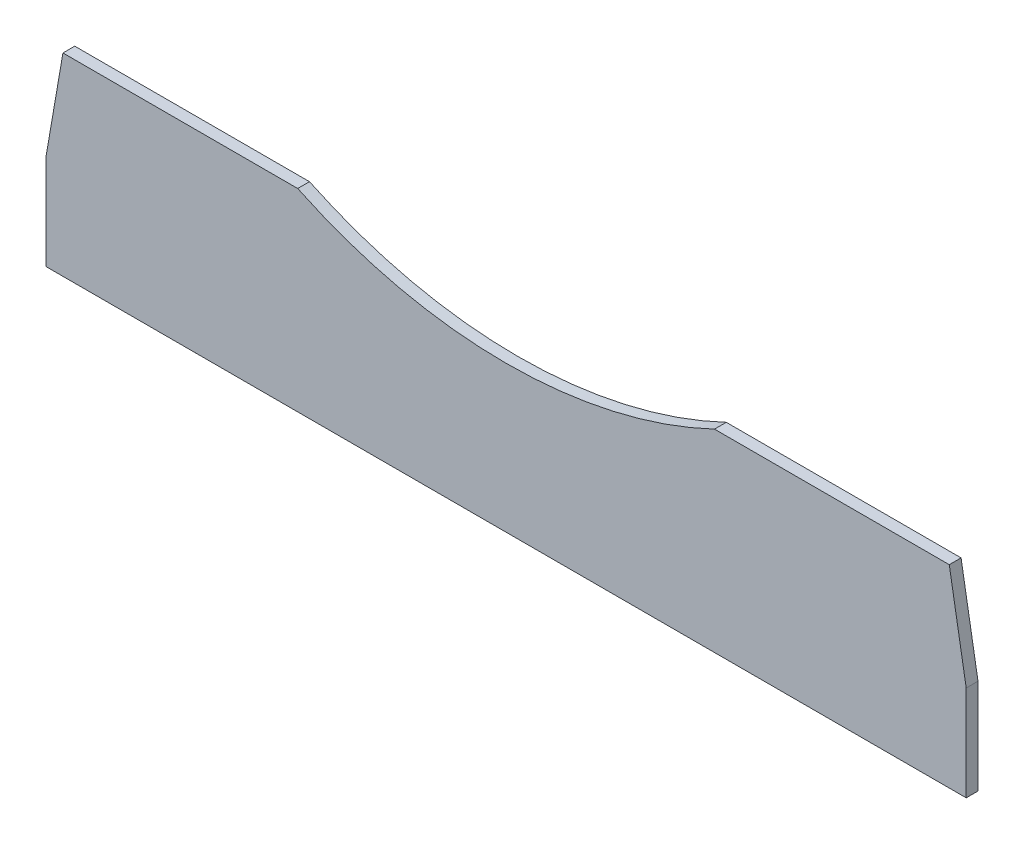
from build123d import *

# Parameters (mm, degrees)
EXTRUDE_1_DEPTH = 1
EXTRUDE_2_DEPTH = 0.2


with BuildPart() as part:
    # 草图1 → 凸台-拉伸1 (new body)
    with BuildSketch(Plane.XY):
        with BuildLine():
            Line((77.564020285, 17.400000002), (57.663521733, 17.400000002))
            ThreePointArc((57.663521733, 17.400000002), (40, 13.400000002), (22.336478267, 17.400000002))
            Line((22.336478267, 17.400000002), (2.435979715, 17.400000002))
            Line((2.435979715, 17.400000002), (1, 9.067418693))
            Line((1, 9.067418693), (1, 1))
            Line((1, 1), (79, 1))
            Line((79, 1), (79, 9.067418693))
            Line((79, 9.067418693), (77.564020285, 17.400000002))
        make_face()
    extrude(amount=EXTRUDE_1_DEPTH)

    # 草图2 → 凸台-拉伸2 (add)
    # profile 1 of 5: a face of its own
    with BuildSketch(Plane(origin=(0, 0, 0), x_dir=(-1, 0, 0), z_dir=(0, 0, -1))):
        with BuildLine():
            Line((-47.688311688, 9.067418693), (-47.688311688, 13.067418693))
            Line((-47.688311688, 13.067418693), (-46.456168831, 13.067418693))
            add(Edge.make_bspline(
                [(-46.456168831, 13.067418693), (-46.420988221, 13.067451705), (-46.353305987, 13.067515216), (-46.255375892, 13.062724044), (-46.164329229, 13.057882688), (-46.080485367, 13.048540998), (-46.003780872, 13.038340211), (-45.934294083, 13.025593097), (-45.872011125, 13.009482907), (-45.833269101, 12.996467591), (-45.814935065, 12.990308303)],
                knots=[0, 0, 0, 0, 1.301145482, 2.503209419, 3.626350361, 4.67304202, 5.622796861, 6.488461115, 7.284688674, 8, 8, 8, 8], degree=3))
            add(Edge.make_bspline(
                [(-45.814935065, 12.990308303), (-45.791719499, 12.981322614), (-45.74534338, 12.963372528), (-45.68001996, 12.927935397), (-45.617705889, 12.888011907), (-45.559107384, 12.842561949), (-45.504568127, 12.790885007), (-45.453234408, 12.734116528), (-45.406126096, 12.671089494), (-45.362722293, 12.603146313), (-45.32230664, 12.530972452), (-45.288936916, 12.453685342), (-45.258960982, 12.372914459), (-45.236153868, 12.287713781), (-45.216879687, 12.198685981), (-45.204603556, 12.105561237), (-45.195853867, 12.008332403), (-45.195160066, 11.942169373), (-45.194805195, 11.908327784)],
                knots=[0, 0, 0, 0, 0.897158766, 1.79219156, 2.674738776, 3.564969572, 4.462552928, 5.381685756, 6.322532571, 7.297145314, 8.28871417, 9.302465757, 10.330585605, 11.393732126, 12.480975679, 13.614163778, 14.779673607, 16, 16, 16, 16], degree=3))
            add(Edge.make_bspline(
                [(-45.194805195, 11.908327784), (-45.195492301, 11.86392354), (-45.196836119, 11.777079255), (-45.210030339, 11.650058884), (-45.23195871, 11.529625528), (-45.261877634, 11.415200622), (-45.300734436, 11.306956964), (-45.348850036, 11.205179001), (-45.405295291, 11.109502236), (-45.469735671, 11.019748146), (-45.545672476, 10.938050274), (-45.635292745, 10.868158341), (-45.736690133, 10.808382382), (-45.851130434, 10.760869847), (-45.977446286, 10.722492562), (-46.116782858, 10.696330241), (-46.268601777, 10.68117741), (-46.373881482, 10.678960123), (-46.428571429, 10.677808303)],
                knots=[0, 0, 0, 0, 1.066125632, 2.085091685, 3.062630143, 4.003547869, 4.922307223, 5.820454748, 6.703048758, 7.586837887, 8.469431897, 9.371589709, 10.306565591, 11.287746888, 12.340181319, 13.471797101, 14.68666727, 16, 16, 16, 16], degree=3))
            Line((-46.428571429, 10.677808303), (-47.272727273, 10.677808303))
            Line((-47.272727273, 10.677808303), (-47.272727273, 9.067418693))
            Line((-47.272727273, 9.067418693), (-47.688311688, 9.067418693))
        make_face()
        with BuildLine():
            Line((-47.272727273, 11.145340771), (-46.402597403, 11.145340771))
            add(Edge.make_bspline(
                [(-46.402597403, 11.145340771), (-46.369576425, 11.146082646), (-46.305597929, 11.147520039), (-46.21273581, 11.155186787), (-46.1267185, 11.169809004), (-46.047573856, 11.189833221), (-45.975522203, 11.215944864), (-45.910204103, 11.247343108), (-45.851992493, 11.285134467), (-45.799970366, 11.328329831), (-45.755631701, 11.378518048), (-45.715747093, 11.433187935), (-45.68340165, 11.494920917), (-45.656968623, 11.562252145), (-45.635497696, 11.634962097), (-45.621331024, 11.713615201), (-45.612275826, 11.797997292), (-45.611030842, 11.856354969), (-45.61038961, 11.886412199)],
                knots=[0, 0, 0, 0, 1.269306236, 2.459294321, 3.577321076, 4.618943517, 5.592639886, 6.518111891, 7.397820391, 8.253919533, 9.107995395, 9.965041305, 10.848919063, 11.777714976, 12.741869721, 13.757527659, 14.845010431, 16, 16, 16, 16], degree=3))
            add(Edge.make_bspline(
                [(-45.61038961, 11.886412199), (-45.611312785, 11.92545432), (-45.613099182, 12.001003068), (-45.63157716, 12.109672401), (-45.66016068, 12.209917325), (-45.701994512, 12.299721411), (-45.750918691, 12.378470811), (-45.80449034, 12.445835227), (-45.864323149, 12.498759859), (-45.920007717, 12.531746424), (-45.968910958, 12.552550358), (-46.012490408, 12.565388633), (-46.062812167, 12.575472764), (-46.119694611, 12.58430334), (-46.183026934, 12.591749249), (-46.252929988, 12.596136189), (-46.329508417, 12.599736152), (-46.382841096, 12.599834714), (-46.410714286, 12.599886225)],
                knots=[0, 0, 0, 0, 1.500314686, 2.903195123, 4.226916567, 5.498136997, 6.699407891, 7.786731959, 8.797026544, 9.75363827, 10.261964553, 10.838097333, 11.497334866, 12.234733717, 13.051831226, 13.948971176, 14.928073425, 16, 16, 16, 16], degree=3))
            Line((-46.410714286, 12.599886225), (-47.272727273, 12.599886225))
            Line((-47.272727273, 12.599886225), (-47.272727273, 11.145340771))
        make_face(mode=Mode.SUBTRACT)
    # profile 2 of 5: a face of its own
    with BuildSketch(Plane(origin=(0, 0, 0), x_dir=(-1, 0, 0), z_dir=(0, 0, -1))):
        Polygon((-44.987012987, 9.067418693), (-43.711038961, 13.067418693), (-43.305194805, 13.067418693), (-42.025974026, 9.067418693), (-42.456980519, 9.067418693), (-42.80762987, 10.262223888), (-44.204545455, 10.262223888), (-44.553571429, 9.067418693), align=None)
        with BuildLine():
            Line((-44.068181818, 10.729756355), (-42.944805195, 10.729756355))
            Line((-42.944805195, 10.729756355), (-43.279220779, 11.828782329))
            add(Edge.make_bspline(
                [(-43.279220779, 11.828782329), (-43.29173135, 11.869888674), (-43.316156416, 11.95014282), (-43.350744536, 12.067659589), (-43.383941273, 12.179122049), (-43.412297682, 12.285307708), (-43.440494748, 12.384834988), (-43.464812799, 12.478811463), (-43.486642302, 12.566770737), (-43.500051875, 12.623683221), (-43.506493506, 12.651022589)],
                knots=[0, 0, 0, 0, 1.20859176, 2.359599242, 3.445754582, 4.479676267, 5.450859039, 6.355343929, 7.209947359, 8, 8, 8, 8], degree=3))
            add(Edge.make_bspline(
                [(-43.506493506, 12.651022589), (-43.518301709, 12.587368598), (-43.541891579, 12.460203651), (-43.583993104, 12.270187907), (-43.63460335, 12.081486108), (-43.67254892, 11.956387708), (-43.691558442, 11.893717394)],
                knots=[0, 0, 0, 0, 0.99576119, 1.989284839, 2.992695748, 4, 4, 4, 4], degree=3))
            Line((-43.691558442, 11.893717394), (-44.068181818, 10.729756355))
        make_face(mode=Mode.SUBTRACT)
    # profile 3 of 5: a face of its own
    with BuildSketch(Plane(origin=(0, 0, 0), x_dir=(-1, 0, 0), z_dir=(0, 0, -1))):
        with BuildLine():
            Line((-41.558441558, 9.067418693), (-41.558441558, 13.067418693))
            Line((-41.558441558, 13.067418693), (-40.089285714, 13.067418693))
            add(Edge.make_bspline(
                [(-40.089285714, 13.067418693), (-40.052209917, 13.06720528), (-39.980445893, 13.066792198), (-39.876485311, 13.060849775), (-39.77981822, 13.052053112), (-39.690573408, 13.040356979), (-39.609271859, 13.024141513), (-39.535591159, 13.00447099), (-39.468931882, 12.982514572), (-39.390676412, 12.946297262), (-39.301396836, 12.890120624), (-39.205108878, 12.80453268), (-39.120768476, 12.698543056), (-39.045718028, 12.576765164), (-38.984084279, 12.440037422), (-38.94042634, 12.290927515), (-38.914070901, 12.131394561), (-38.910779778, 12.021526006), (-38.909090909, 11.965145965)],
                knots=[0, 0, 0, 0, 0.957775898, 1.853873864, 2.6892683, 3.465319774, 4.178195347, 4.829309051, 5.435011313, 5.988660553, 7.053440284, 8.147710094, 9.30058322, 10.540256924, 11.835580405, 13.162637032, 14.543981594, 16, 16, 16, 16], degree=3))
            add(Edge.make_bspline(
                [(-38.909090909, 11.965145965), (-38.909973941, 11.927784357), (-38.911698778, 11.854805456), (-38.92214738, 11.747842226), (-38.940304638, 11.646381982), (-38.968073048, 11.55068726), (-39.000277595, 11.459568893), (-39.042566311, 11.374624131), (-39.091084554, 11.294755916), (-39.147476522, 11.220599066), (-39.210553009, 11.152318947), (-39.281343221, 11.090988836), (-39.35847071, 11.03573787), (-39.442536858, 10.987051182), (-39.533021388, 10.944305572), (-39.630994605, 10.910196388), (-39.734929575, 10.880326083), (-39.80722523, 10.866625249), (-39.844155844, 10.859626485)],
                knots=[0, 0, 0, 0, 1.121977975, 2.191573688, 3.224240956, 4.211948119, 5.180998842, 6.122125515, 7.055751929, 7.983633331, 8.914994346, 9.842128418, 10.791356962, 11.759862547, 12.75578979, 13.791489111, 14.871831714, 16, 16, 16, 16], degree=3))
            add(Edge.make_bspline(
                [(-39.844155844, 10.859626485), (-39.816897295, 10.844544991), (-39.765007597, 10.815835678), (-39.693994652, 10.769515952), (-39.633305939, 10.722892864), (-39.598998048, 10.688964662), (-39.582792208, 10.672938173)],
                knots=[0, 0, 0, 0, 1.158843086, 2.205987482, 3.152571606, 4, 4, 4, 4], degree=3))
            add(Edge.make_bspline(
                [(-39.582792208, 10.672938173), (-39.5503783, 10.633813285), (-39.485185993, 10.555123553), (-39.395817713, 10.42958395), (-39.310214673, 10.298987648), (-39.259944538, 10.207119882), (-39.234577922, 10.160762849)],
                knots=[0, 0, 0, 0, 0.982253192, 1.975551771, 2.978451105, 4, 4, 4, 4], degree=3))
            Line((-39.234577922, 10.160762849), (-38.649350649, 9.067418693))
            Line((-38.649350649, 9.067418693), (-39.121753247, 9.067418693))
            Line((-39.121753247, 9.067418693), (-39.583603896, 9.922938173))
            add(Edge.make_bspline(
                [(-39.583603896, 9.922938173), (-39.605118993, 9.963052356), (-39.646272238, 10.03978121), (-39.707347924, 10.14872487), (-39.76412205, 10.24697591), (-39.816498737, 10.334630155), (-39.865254187, 10.410757684), (-39.909043681, 10.476404598), (-39.949146719, 10.530823312), (-39.997143707, 10.586891022), (-40.052932409, 10.645010938), (-40.119251608, 10.703381552), (-40.185493782, 10.748631637), (-40.252937393, 10.78309104), (-40.327178324, 10.805791876), (-40.410833242, 10.822783743), (-40.507644085, 10.832026033), (-40.576280757, 10.833087374), (-40.612824675, 10.833652459)],
                knots=[0, 0, 0, 0, 1.483643366, 2.83785556, 4.070616892, 5.1822306, 6.165666296, 7.016844219, 7.754091418, 8.367230408, 9.421242841, 10.377779407, 11.241203819, 12.029974219, 12.835959019, 13.762973995, 14.808950166, 16, 16, 16, 16], degree=3))
            Line((-40.612824675, 10.833652459), (-41.142857143, 10.833652459))
            Line((-41.142857143, 10.833652459), (-41.142857143, 9.067418693))
            Line((-41.142857143, 9.067418693), (-41.558441558, 9.067418693))
        make_face()
        with BuildLine():
            Line((-41.142857143, 11.301184926), (-40.168019481, 11.301184926))
            add(Edge.make_bspline(
                [(-40.168019481, 11.301184926), (-40.117939328, 11.302160492), (-40.024084235, 11.303988797), (-39.892780987, 11.316131394), (-39.780709904, 11.338104918), (-39.685777605, 11.370108353), (-39.604827592, 11.412513987), (-39.53435, 11.465026721), (-39.472531873, 11.527742047), (-39.419948954, 11.60028379), (-39.376471908, 11.681067768), (-39.347128412, 11.769872592), (-39.327211224, 11.864152396), (-39.325534388, 11.929323136), (-39.324675325, 11.9627109)],
                knots=[0, 0, 0, 0, 1.47306528, 2.760668081, 3.873497699, 4.82484281, 5.696997418, 6.550136397, 7.399890849, 8.276969651, 9.17766846, 10.086208714, 11.019541422, 12, 12, 12, 12], degree=3))
            add(Edge.make_bspline(
                [(-39.324675325, 11.9627109), (-39.32542561, 11.986806732), (-39.32688831, 12.033782189), (-39.334584202, 12.102408844), (-39.349604309, 12.166988394), (-39.369422413, 12.22786787), (-39.396066703, 12.284491073), (-39.427180932, 12.337751806), (-39.466365711, 12.385460317), (-39.509007889, 12.430626029), (-39.558356729, 12.470722871), (-39.613466297, 12.505465882), (-39.674325486, 12.534650642), (-39.740349995, 12.559675366), (-39.81287988, 12.576320945), (-39.890215321, 12.590737791), (-39.973317672, 12.598730658), (-40.030558163, 12.599493163), (-40.060064935, 12.599886225)],
                knots=[0, 0, 0, 0, 1.045235731, 2.037714497, 2.988326782, 3.915852726, 4.808207886, 5.697550021, 6.58254782, 7.478674216, 8.387536059, 9.331464042, 10.296946822, 11.310355404, 12.385965615, 13.518246496, 14.720686494, 16, 16, 16, 16], degree=3))
            Line((-40.060064935, 12.599886225), (-41.142857143, 12.599886225))
            Line((-41.142857143, 12.599886225), (-41.142857143, 11.301184926))
        make_face(mode=Mode.SUBTRACT)
    # profile 4 of 5: a face of its own
    with BuildSketch(Plane(origin=(0, 0, 0), x_dir=(-1, 0, 0), z_dir=(0, 0, -1))):
        Polygon((-37.402597403, 9.067418693), (-37.402597403, 12.599886225), (-38.493506494, 12.599886225), (-38.493506494, 13.067418693), (-35.896103896, 13.067418693), (-35.896103896, 12.599886225), (-36.987012987, 12.599886225), (-36.987012987, 9.067418693), align=None)
    # profile 5 of 5: a face of its own
    with BuildSketch(Plane(origin=(0, 0, 0), x_dir=(-1, 0, 0), z_dir=(0, 0, -1))):
        Polygon((-33.038961039, 9.067418693), (-33.038961039, 10.05443168), (-34.441558442, 10.05443168), (-34.441558442, 10.521964147), (-33.015422078, 13.119366745), (-32.623376623, 13.119366745), (-32.623376623, 10.521964147), (-32.155844156, 10.521964147), (-32.155844156, 10.05443168), (-32.623376623, 10.05443168), (-32.623376623, 9.067418693), align=None)
        Polygon((-33.038961039, 10.521964147), (-33.038961039, 12.329594017), (-34.031655844, 10.521964147), align=None, mode=Mode.SUBTRACT)
    extrude(amount=EXTRUDE_2_DEPTH)


solid = part.part
